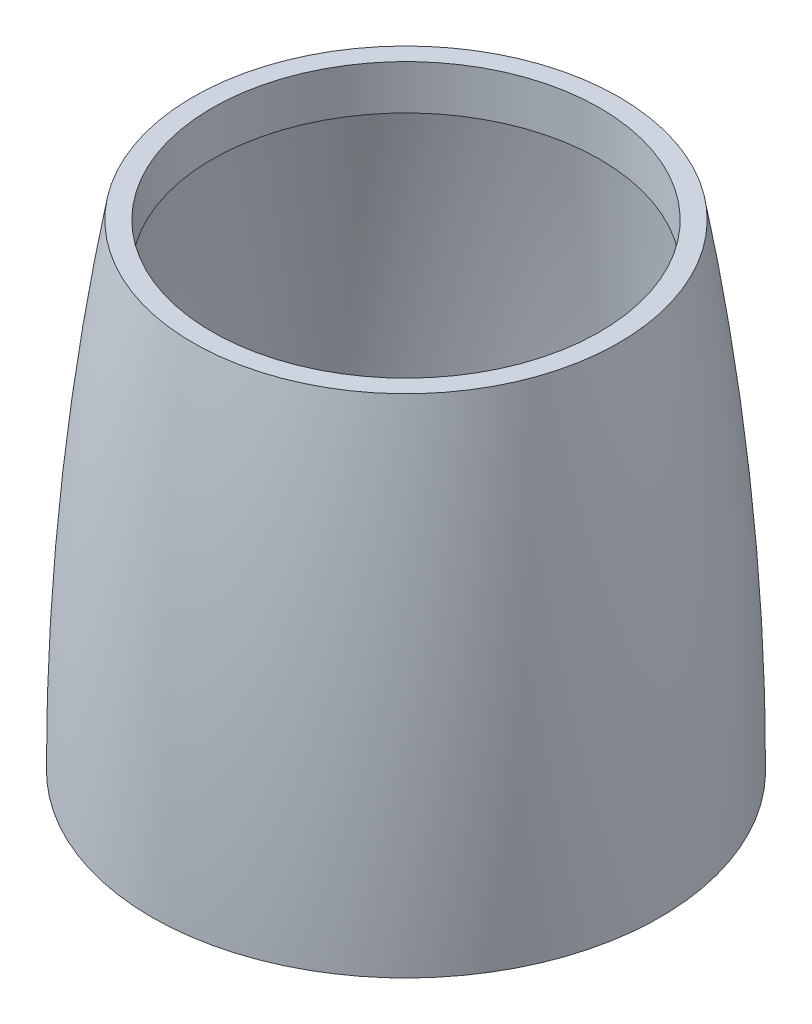
from build123d import *


with BuildPart() as part:
    # Sketch1 → Revolve1 (revolve)
    with BuildSketch(Plane.XY):
        with BuildLine():
            ThreePointArc((31.626449106, 68), (35.654521568, 34.105993056), (37, 0))
            Line((37, 0), (40, 0))
            ThreePointArc((40, 0), (38.371960017, 37.640569868), (33.5, 75))
            Line((33.5, 75), (30.5, 75))
            Line((30.5, 75), (30.5, 68))
            Line((30.5, 68), (31.626449106, 68))
        make_face()
    revolve(axis=Axis((0, 0, 0), (0, 1, 0)))


solid = part.part
